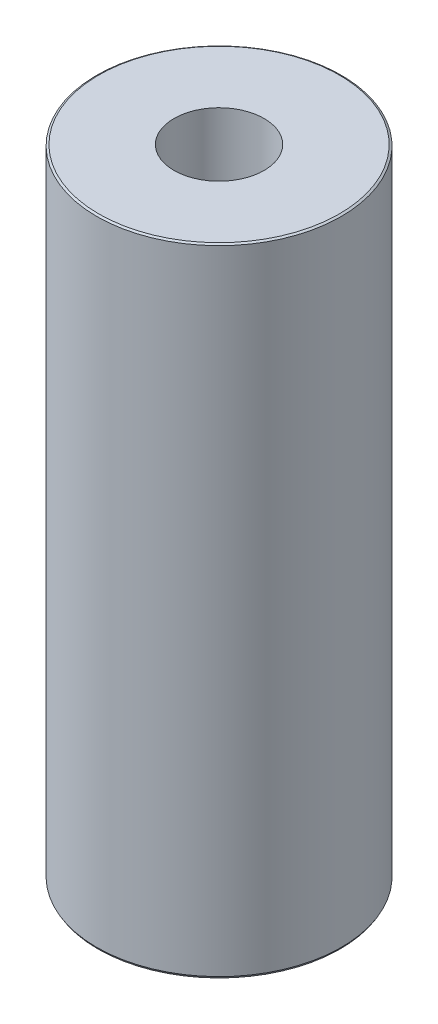
from build123d import *
from OCP.BRepFilletAPI import BRepFilletAPI_MakeChamfer

# Parameters (mm, degrees)
SKETCH1_R           = 22.5
BOSS_EXTRUDE1_DEPTH = 117.023352804
SKETCH2_R           = 8.287906644
CUT_EXTRUDE1_DEPTH  = 122.272276723
CHAMFER1_SIZE       = 0.213913758
CHAMFER1_SIZE2      = 0.370509496


with BuildPart() as part:
    # Sketch1 → Boss-Extrude1 (new body)
    with BuildSketch(Plane(origin=(0, 0, 0), x_dir=(1, 0, 0), z_dir=(0, 1, 0))):
        Circle(SKETCH1_R)
    extrude(amount=BOSS_EXTRUDE1_DEPTH)

    # Sketch2 → Cut-Extrude1 (cut, through all)
    with BuildSketch(Plane(origin=(0, 0, 0), x_dir=(1, 0, 0), z_dir=(0, 1, 0))):
        Circle(SKETCH2_R)
    extrude(amount=CUT_EXTRUDE1_DEPTH, mode=Mode.SUBTRACT)

    # Chamfer1: one chamfer whose edges measure the first distance from different faces: ONE call of the kernel's chamfer builder (chamfer() names one face for all edges)
    chamfer1_edges_1 = [part.edges().sort_by_distance(p)[0] for p in [
        (-22.5, 117.023352804, 0),
    ]]
    chamfer1_side_1 = [part.faces().sort_by_distance(p)[0] for p in [
        (-22.5, 58.511676402, 0),
    ]]
    chamfer1_edges_2 = [part.edges().sort_by_distance(p)[0] for p in [
        (-22.5, 0, 0),
    ]]
    chamfer1_side_2 = [part.faces().sort_by_distance(p)[0] for p in [
        (-21.863603897, 0, 0),
    ]]
    chamfer1 = BRepFilletAPI_MakeChamfer(part.part.solid().wrapped)
    for e in chamfer1_edges_1:
        chamfer1.Add(CHAMFER1_SIZE, CHAMFER1_SIZE2, e.wrapped, chamfer1_side_1[0].wrapped)  # the first distance lies on this face
    for e in chamfer1_edges_2:
        chamfer1.Add(CHAMFER1_SIZE, CHAMFER1_SIZE2, e.wrapped, chamfer1_side_2[0].wrapped)  # the first distance lies on this face
    add(Compound.cast(chamfer1.Shape()), mode=Mode.REPLACE)


solid = part.part
